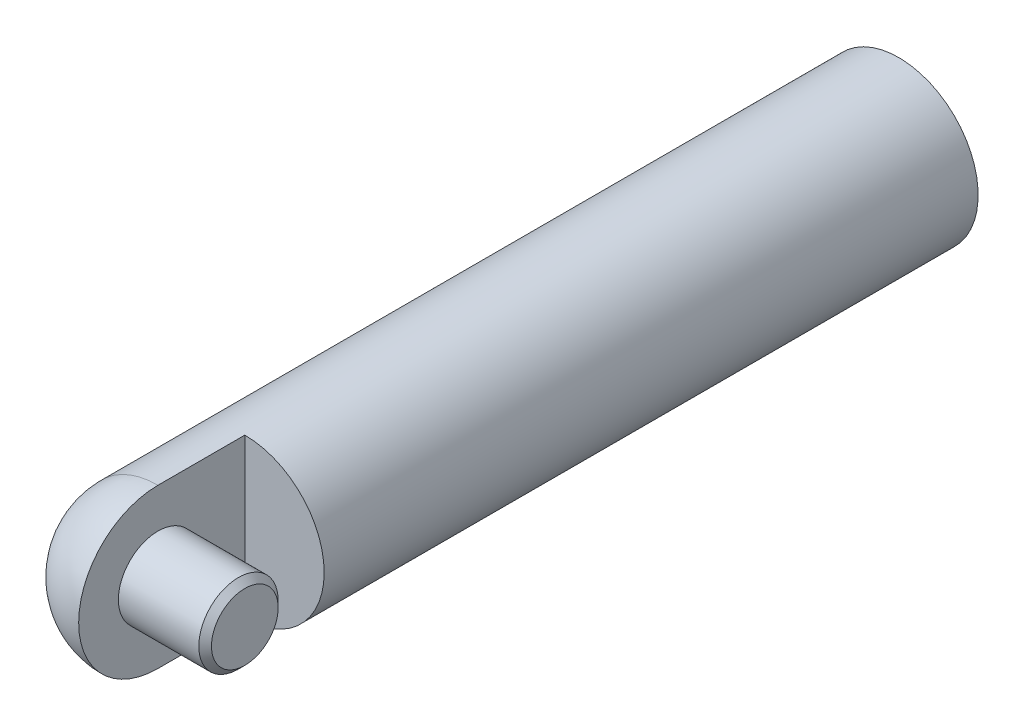
from build123d import *

# Parameters (mm, degrees)
CUT_EXTRUDE2_DEPTH  = 199.684995659
SKETCH2_4_R         = 9.525
BOSS_EXTRUDE1_DEPTH = 20.828
CHAMFER1_SIZE       = 1.524


with BuildPart() as part:
    # Sketch1 → Revolve1 (revolve)
    with BuildSketch(Plane.YZ):
        with BuildLine():
            Line((0, 0), (-19.05, 0))
            Line((-19.05, 0), (-19.05, 177.8))
            ThreePointArc((-19.05, 177.8), (-13.470384182, 191.270384182), (0, 196.85))
            Line((0, 196.85), (0, 177.8))
            Line((0, 177.8), (0, 0))
        make_face()
    revolve(axis=Axis((0, 0, 0), (0, 0, 1)))

    # Sketch2 → Cut-Extrude2 (cut, through all)
    with BuildSketch(Plane.YZ):
        with BuildLine():
            Line((19.05, 156.972), (19.05, 177.8))
            ThreePointArc((19.05, 177.8), (0, 196.85), (-19.05, 177.8))
            Line((-19.05, 177.8), (-19.05, 156.972))
            Line((-19.05, 156.972), (19.05, 156.972))
        make_face()
    extrude(amount=CUT_EXTRUDE2_DEPTH, mode=Mode.SUBTRACT)

    # Sketch2<4> → Boss-Extrude1 (add)
    with BuildSketch(Plane.YZ):
        with Locations((0, 177.8)):
            Circle(SKETCH2_4_R)
    extrude(amount=BOSS_EXTRUDE1_DEPTH)

    # Chamfer1
    chamfer1_edges = [part.edges().sort_by_distance(p)[0] for p in [
        (20.828, -9.525, 177.8),
    ]]
    chamfer(chamfer1_edges, length=CHAMFER1_SIZE)


solid = part.part
